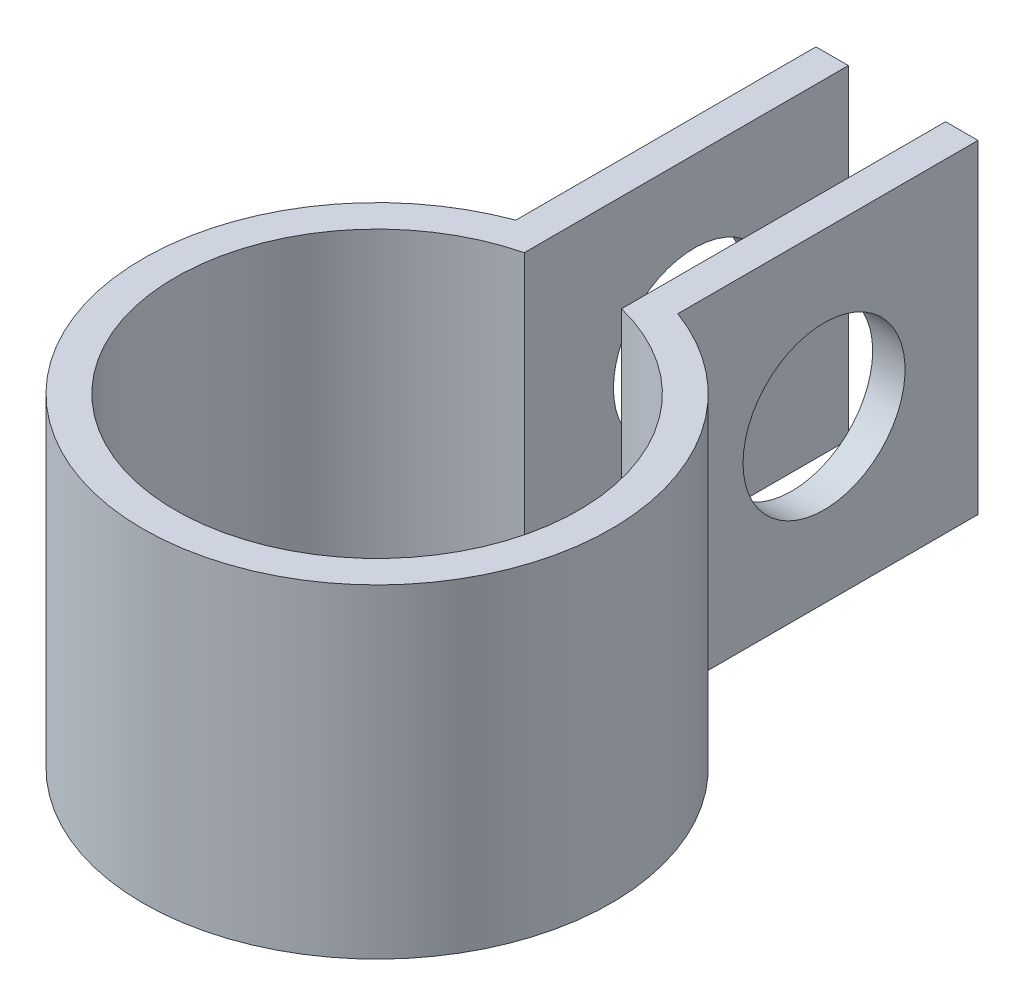
from build123d import *

# Parameters (mm, degrees)
BOSS_EXTRUDE1_DEPTH = 5.08
SKETCH2_R           = 1.27
CUT_EXTRUDE1_DEPTH  = 11.799125896


with BuildPart() as part:
    # Sketch1 → Boss-Extrude1 (new body)
    with BuildSketch(Plane(origin=(0, 0, 0), x_dir=(1, 0, 0), z_dir=(0, 1, 0))):
        with BuildLine():
            Line((-1.27, 3.443574029), (-1.27, 8.149119954))
            Line((-1.27, 8.149119954), (-0.762, 8.149119954))
            Line((-0.762, 8.149119954), (-0.762, 3.069119954))
            ThreePointArc((-0.762, 3.069119954), (0, -3.1623), (0.762, 3.069119954))
            Line((0.762, 3.069119954), (0.762, 8.149119954))
            Line((0.762, 8.149119954), (1.27, 8.149119954))
            Line((1.27, 8.149119954), (1.27, 3.443574029))
            ThreePointArc((1.27, 3.443574029), (0, -3.6703), (-1.27, 3.443574029))
        make_face()
    extrude(amount=BOSS_EXTRUDE1_DEPTH)

    # Sketch2 → Cut-Extrude1 (cut, through all)
    with BuildSketch(Plane.ZY.offset(1.27)):
        with Locations((-5.736119954, 2.54)):
            Circle(SKETCH2_R)
    extrude(amount=-CUT_EXTRUDE1_DEPTH, mode=Mode.SUBTRACT)


solid = part.part
